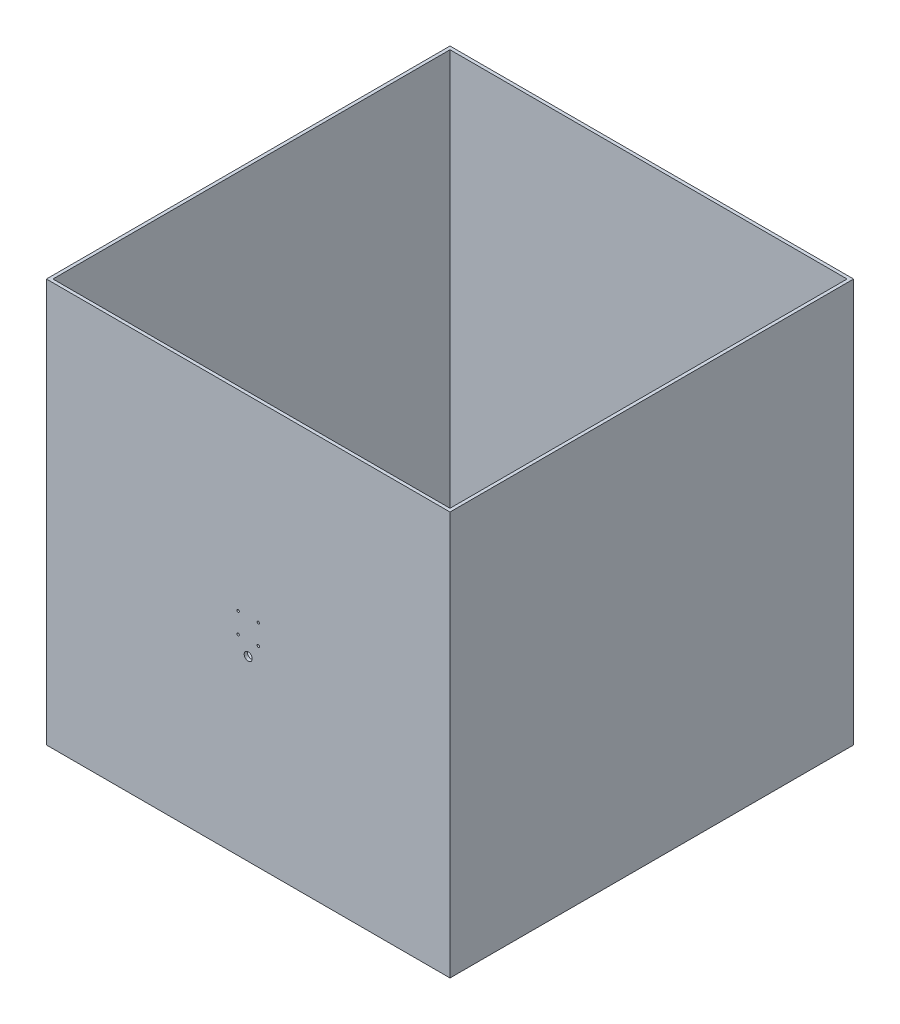
from build123d import *

# Parameters (mm, degrees)
SKETCH1_W           = 500
SKETCH1_H           = 500
BOSS_EXTRUDE1_DEPTH = 500
SHELL1_T            = -4
CUT_EXTRUDE1_REACH  = 752
SKETCH2_R           = 1.5
SKETCH2_R_2         = 5


with BuildPart() as part:
    # Sketch1 → Boss-Extrude1 (new body)
    with BuildSketch(Plane(origin=(0, 0, 0), x_dir=(1, 0, 0), z_dir=(0, 1, 0))):
        Rectangle(SKETCH1_W, SKETCH1_H)
    extrude(amount=BOSS_EXTRUDE1_DEPTH)

    # Shell1
    shell1_openings = [part.faces().sort_by_distance(p)[0] for p in [
        (0, 500, 0),
    ]]
    offset(amount=SHELL1_T, openings=shell1_openings, kind=Kind.INTERSECTION)

    # Sketch2 → Cut-Extrude1 (cut, up to next)
    with BuildSketch(Plane.XY.offset(250), mode=Mode.PRIVATE) as cut_extrude1_sk1:
        with Locations((-12.5, 262.5)):
            Circle(SKETCH2_R)
    cut_extrude1_tool1 = extrude(cut_extrude1_sk1.sketch, amount=-CUT_EXTRUDE1_REACH, mode=Mode.PRIVATE) & part.part
    # Sketch2 → Cut-Extrude1 (cut, up to next)
    with BuildSketch(Plane.XY.offset(250), mode=Mode.PRIVATE) as cut_extrude1_sk2:
        with Locations((12.5, 262.5)):
            Circle(SKETCH2_R)
    cut_extrude1_tool2 = extrude(cut_extrude1_sk2.sketch, amount=-CUT_EXTRUDE1_REACH, mode=Mode.PRIVATE) & part.part
    # Sketch2 → Cut-Extrude1 (cut, up to next)
    with BuildSketch(Plane.XY.offset(250), mode=Mode.PRIVATE) as cut_extrude1_sk3:
        with Locations((12.5, 237.5)):
            Circle(SKETCH2_R)
    cut_extrude1_tool3 = extrude(cut_extrude1_sk3.sketch, amount=-CUT_EXTRUDE1_REACH, mode=Mode.PRIVATE) & part.part
    # Sketch2 → Cut-Extrude1 (cut, up to next)
    with BuildSketch(Plane.XY.offset(250), mode=Mode.PRIVATE) as cut_extrude1_sk4:
        with Locations((-12.5, 237.5)):
            Circle(SKETCH2_R)
    cut_extrude1_tool4 = extrude(cut_extrude1_sk4.sketch, amount=-CUT_EXTRUDE1_REACH, mode=Mode.PRIVATE) & part.part
    # Sketch2 → Cut-Extrude1 (cut, up to next)
    with BuildSketch(Plane.XY.offset(250), mode=Mode.PRIVATE) as cut_extrude1_sk5:
        with Locations((0, 220)):
            Circle(SKETCH2_R_2)
    cut_extrude1_tool5 = extrude(cut_extrude1_sk5.sketch, amount=-CUT_EXTRUDE1_REACH, mode=Mode.PRIVATE) & part.part
    add(cut_extrude1_tool1.solids().sort_by_distance((-12.5, 262.5, 250))[0], mode=Mode.SUBTRACT)
    add(cut_extrude1_tool2.solids().sort_by_distance((12.5, 262.5, 250))[0], mode=Mode.SUBTRACT)
    add(cut_extrude1_tool3.solids().sort_by_distance((12.5, 237.5, 250))[0], mode=Mode.SUBTRACT)
    add(cut_extrude1_tool4.solids().sort_by_distance((-12.5, 237.5, 250))[0], mode=Mode.SUBTRACT)
    add(cut_extrude1_tool5.solids().sort_by_distance((0, 220, 250))[0], mode=Mode.SUBTRACT)


solid = part.part
